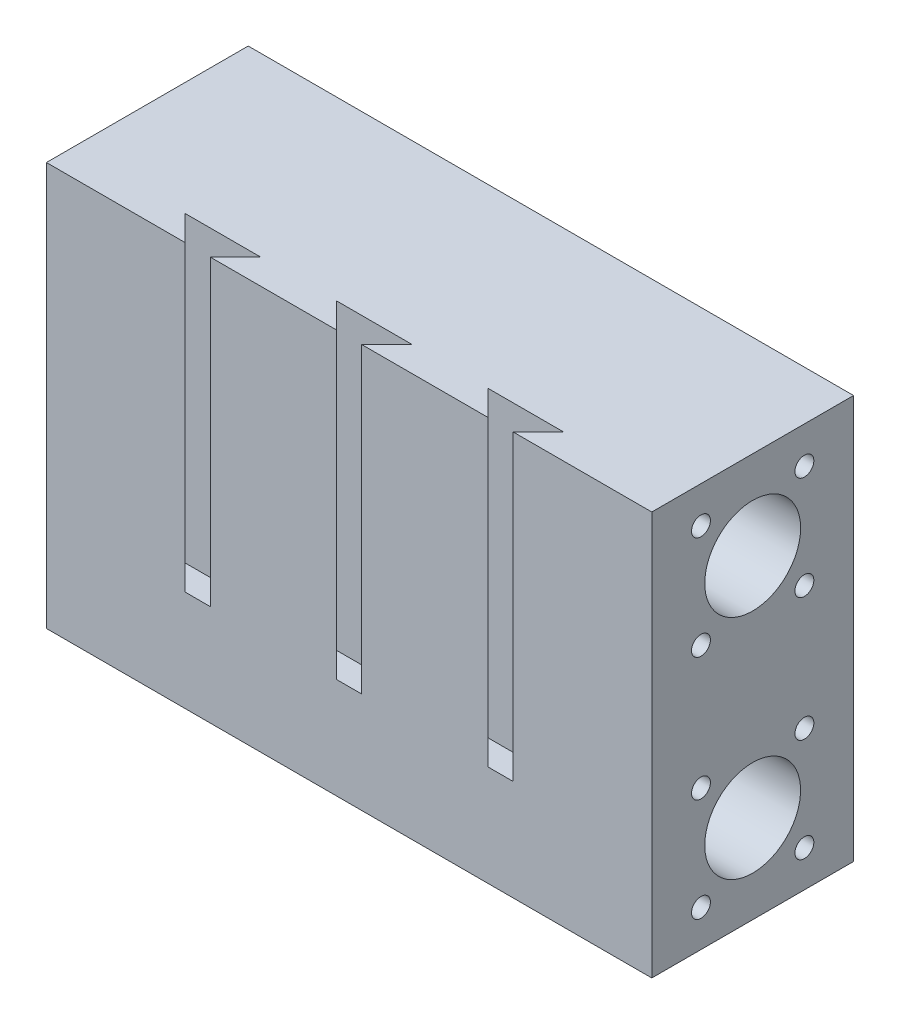
from build123d import *

# Parameters (mm, degrees)
SKETCH1_W                        = 120
SKETCH1_H                        = 80
BOSS_EXTRUDE1_DEPTH              = 40
SKETCH2_R                        = 1.85
LINEAR_BEARING_SCREW_CUTS_DEPTH  = 14
SKETCH3_R                        = 9.5
LINEAR_BEARINGS_HOLE_DEPTH       = 55
SKETCH4_R                        = 1.875
LINEAR_BEARING_SCREW_CUTS2_DEPTH = 14
LINEAR_BEARINGS_HOLE2_START      = -55
SKETCH5_R                        = 9.5
LINEAR_BEARINGS_HOLE2_DEPTH      = 55
CUT_EXTRUDE7_DEPTH               = 60


with BuildPart() as part:
    # Sketch1 → Boss-Extrude1 (new body)
    with BuildSketch(Plane.XY):
        with Locations((60, 40)):
            Rectangle(SKETCH1_W, SKETCH1_H)
    extrude(amount=BOSS_EXTRUDE1_DEPTH)

    # Sketch2 → linear-bearing-screw-cuts (cut)
    with BuildSketch(Plane.ZY):
        with Locations((30.25, 72.75)):
            Circle(SKETCH2_R)
        with Locations((9.75, 72.75)):
            Circle(SKETCH2_R)
        with Locations((30.25, 52.25)):
            Circle(SKETCH2_R)
        with Locations((9.75, 52.25)):
            Circle(SKETCH2_R)
        with Locations((9.75, 27.75)):
            Circle(SKETCH2_R)
        with Locations((30.25, 27.75)):
            Circle(SKETCH2_R)
        with Locations((30.25, 7.25)):
            Circle(SKETCH2_R)
        with Locations((9.75, 7.25)):
            Circle(SKETCH2_R)
    extrude(amount=-LINEAR_BEARING_SCREW_CUTS_DEPTH, mode=Mode.SUBTRACT)

    # Sketch3 → linear-bearings-hole (cut)
    with BuildSketch(Plane.ZY):
        with Locations((20, 62.5)):
            Circle(SKETCH3_R)
        with Locations((20, 17.5)):
            Circle(SKETCH3_R)
    extrude(amount=-LINEAR_BEARINGS_HOLE_DEPTH, mode=Mode.SUBTRACT)

    # Sketch4 → linear-bearing-screw-cuts2 (cut)
    with BuildSketch(Plane(origin=(120, 0, 0), x_dir=(0, 0, -1), z_dir=(1, 0, 0))):
        with Locations((-9.75, 72.75)):
            Circle(SKETCH4_R)
        with Locations((-30.25, 72.75)):
            Circle(SKETCH4_R)
        with Locations((-9.75, 52.25)):
            Circle(SKETCH4_R)
        with Locations((-30.25, 52.25)):
            Circle(SKETCH4_R)
        with Locations((-30.25, 27.75)):
            Circle(SKETCH4_R)
        with Locations((-9.75, 27.75)):
            Circle(SKETCH4_R)
        with Locations((-9.75, 7.25)):
            Circle(SKETCH4_R)
        with Locations((-30.25, 7.25)):
            Circle(SKETCH4_R)
    extrude(amount=-LINEAR_BEARING_SCREW_CUTS2_DEPTH, mode=Mode.SUBTRACT)

    # Sketch5 → linear-bearings-hole2 (cut)
    with BuildSketch(Plane(origin=(120, 0, 0), x_dir=(0, 0, -1), z_dir=(1, 0, 0)).offset(LINEAR_BEARINGS_HOLE2_START)):
        with Locations((-20, 62.5)):
            Circle(SKETCH5_R)
        with Locations((-20, 17.5)):
            Circle(SKETCH5_R)
    extrude(amount=LINEAR_BEARINGS_HOLE2_DEPTH, mode=Mode.SUBTRACT)

    # Sketch10 → Cut-Extrude7 (cut)
    with BuildSketch(Plane(origin=(0, 80, 0), x_dir=(1, 0, 0), z_dir=(0, 1, 0))):
        Polygon((92.5, -40), (97.5, -35), (82.5, -35), (87.5, -40), align=None)
        Polygon((67.5, -35), (62.5, -40), (57.5, -40), (52.5, -35), align=None)
        Polygon((37.5, -35), (32.5, -40), (27.5, -40), (22.5, -35), align=None)
    extrude(amount=-CUT_EXTRUDE7_DEPTH, mode=Mode.SUBTRACT)


solid = part.part
